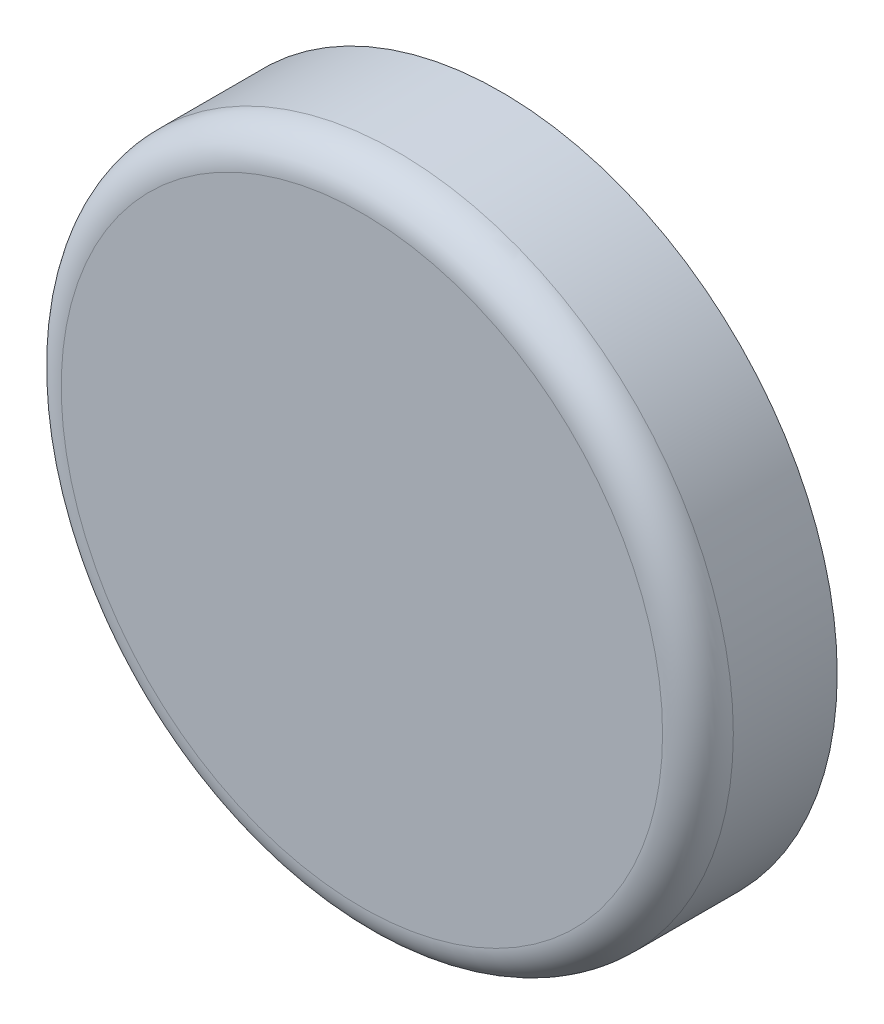
from build123d import *

# Parameters (mm, degrees)
SKETCH1_R           = 12.065
BOSS_EXTRUDE1_DEPTH = 5
SKETCH3_R           = 1.5
BOSS_EXTRUDE2_DEPTH = 2.54
FILLET1_R           = 1.27


with BuildPart() as part:
    # Sketch1 → Boss-Extrude1 (new body)
    with BuildSketch(Plane.XY):
        Circle(SKETCH1_R)
    extrude(amount=BOSS_EXTRUDE1_DEPTH)

    # Sketch3 → Boss-Extrude2 (add)
    with BuildSketch(Plane(origin=(0, 0, 0), x_dir=(-1, 0, 0), z_dir=(0, 0, -1))):
        Circle(SKETCH3_R)
    extrude(amount=BOSS_EXTRUDE2_DEPTH)

    # Fillet1
    fillet1_edges = [part.edges().sort_by_distance(p)[0] for p in [
        (-12.065, 0, 5),
    ]]
    fillet(fillet1_edges, radius=FILLET1_R)


solid = part.part
